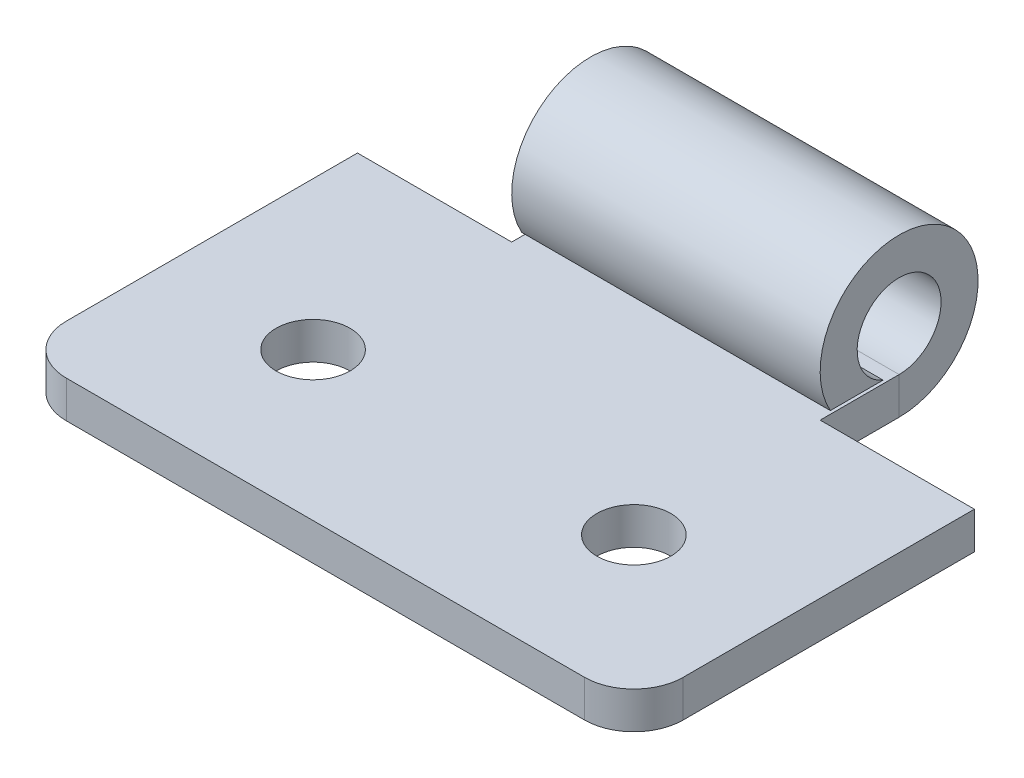
from build123d import *

# Parameters (mm, degrees)
SKETCH_1_W             = 25
SKETCH_1_H             = 15
SM_BASE_FLANGE_1_DEPTH = 1.5
SKETCH_6_W             = 12.5
SKETCH_6_H             = 2
EXTRUDE_1_DEPTH        = 1.5
SM_BASE_FLANGE_2_DEPTH = 12.5
SKETCH_10_R            = 1.5
CUT_EXTRUDE_1_DEPTH    = 33.512305363
FILLET_1_R             = 2
SKETCH_11_W            = 7.74464046
SKETCH_11_H            = 1.2
SKETCH_11_W_2          = 7.487333485
CUT_EXTRUDE_2_DEPTH    = 25


# Sheet-metal steps are written as plain solids
with BuildPart() as part:
    # Sketch 1 → 基体-法兰1 (new body)
    with BuildSketch(Plane(origin=(0, 0, 0), x_dir=(1, 0, 0), z_dir=(0, 1, 0))):
        with Locations((12.5, 7.5)):
            Rectangle(SKETCH_1_W, SKETCH_1_H)
    extrude(amount=-SM_BASE_FLANGE_1_DEPTH)

    # 草图6 → 凸台-拉伸1 (add)
    with BuildSketch(Plane(origin=(0, 0, 0), x_dir=(1, 0, 0), z_dir=(0, 1, 0))):
        with Locations((12.5, 16)):
            Rectangle(SKETCH_6_W, SKETCH_6_H)
    extrude(amount=-EXTRUDE_1_DEPTH)

    # 草图10 → 切除-拉伸1 (cut, through all)
    with BuildSketch(Plane(origin=(0, 0, 0), x_dir=(1, 0, 0), z_dir=(0, 1, 0))):
        with Locations(Location((19, 6, 0), (0, 0, 270))):
            Circle(SKETCH_10_R)
        with Locations(Location((6, 6, 0), (0, 0, 270))):
            Circle(SKETCH_10_R)
    extrude(amount=-CUT_EXTRUDE_1_DEPTH, mode=Mode.SUBTRACT)

    # 圆角1
    fillet_1_edges = [part.edges().sort_by_distance(p)[0] for p in [
        (25, -0.75, 0),
        (0, -0.75, 0),
    ]]
    fillet(fillet_1_edges, radius=FILLET_1_R)

    # 草图11 → 切除-拉伸2 (cut)
    with BuildSketch(Plane(origin=(0, 0, 0), x_dir=(1, 0, 0), z_dir=(0, 1, 0))):
        with Locations((22.62232023, 14.4)):
            Rectangle(SKETCH_11_W, SKETCH_11_H)
        with Locations((2.506333257, 14.4)):
            Rectangle(SKETCH_11_W_2, SKETCH_11_H)
    extrude(amount=-CUT_EXTRUDE_2_DEPTH, mode=Mode.SUBTRACT)


with BuildPart() as body_2:
    # 草图7 → 基体-法兰2 (new body)
    with BuildSketch(Plane(origin=(18.75, 0, 0), x_dir=(0, 0, -1), z_dir=(1, 0, 0))):
        with BuildLine():
            Line((17, 0), (17, -1.5))
            ThreePointArc((17, -1.5), (18.614461494, 4.462881482), (14.212146397, 0.129053697))
            Line((14.212146397, 0.129053697), (16.350286437, 0.129053697))
            ThreePointArc((16.350286437, 0.129053697), (17.331203325, 3.367424468), (17, 0))
        make_face()
    extrude(amount=-SM_BASE_FLANGE_2_DEPTH)


solid = Compound([part.part, body_2.part])
